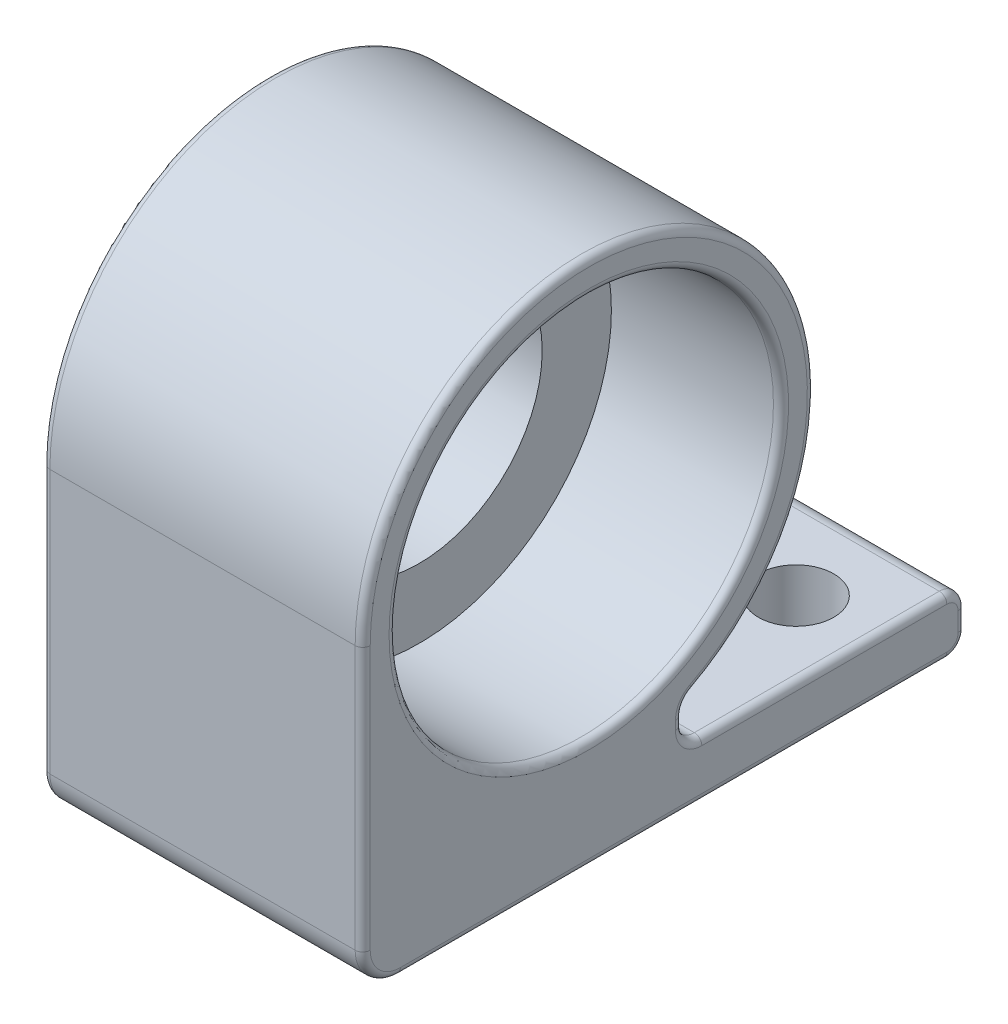
from build123d import *

# Parameters (mm, degrees)
EXTRUDE_1_DEPTH             = 8.5
SKETCH_2_R                  = 2
CUT_EXTRUDE_1_DEPTH         = 10
SKETCH_6_R                  = 5.1
CUT_EXTRUDE_3_DEPTH         = 4.5
HOLE_WIZARD_5_16_18_1_D     = 6.5278
HOLE_WIZARD_5_16_18_1_DEPTH = 3.2
HOLE_WIZARD_5_16_18_1_TIP   = 1.961148974
CUT_EXTRUDE_2_REACH         = 20.125
SKETCH_5_R                  = 1
FILLET_1_R                  = 0.2


with BuildPart() as part:
    # 草图1 → 凸台-拉伸1 (new body)
    with BuildSketch(Plane(origin=(0, 0, 0), x_dir=(0, 0, -1), z_dir=(1, 0, 0))):
        with BuildLine():
            Line((0, -8), (9.5, -8))
            ThreePointArc((9.5, -8), (9.853553391, -7.853553391), (10, -7.5))
            Line((10, -7.5), (10, -7))
            ThreePointArc((10, -7), (9.853553391, -6.646446609), (9.5, -6.5))
            Line((9.5, -6.5), (3, -6.5))
            ThreePointArc((3, -6.5), (2.646446609, -6.353553391), (2.5, -6))
            Line((2.5, -6), (2.5, -5.766281297))
            ThreePointArc((2.5, -5.766281297), (2.572574793, -5.506844037), (2.769230769, -5.322721198))
            ThreePointArc((2.769230769, -5.322721198), (3.11324713, 5.129102486), (-6, 0))
            Line((-6, 0), (-6, -7))
            ThreePointArc((-6, -7), (-5.707106781, -7.707106781), (-5, -8))
            Line((-5, -8), (0, -8))
        make_face()
    extrude(amount=EXTRUDE_1_DEPTH)

    # 草图2 → 切除-拉伸1 (cut)
    with BuildSketch(Plane.ZY):
        Circle(SKETCH_2_R)
    extrude(amount=-CUT_EXTRUDE_1_DEPTH, mode=Mode.SUBTRACT)

    # 草图6 → 切除-拉伸3 (cut)
    with BuildSketch(Plane(origin=(8.5, 0, 0), x_dir=(0, 0, -1), z_dir=(1, 0, 0))):
        Circle(SKETCH_6_R)
    extrude(amount=-CUT_EXTRUDE_3_DEPTH, mode=Mode.SUBTRACT)

    # 5/16-18 螺纹孔1
    with Locations(Plane(origin=(4, 0, 0), x_dir=(0, 0, -1), z_dir=(1, 0, 0))):
        with Locations((0, 0)):
            Hole(HOLE_WIZARD_5_16_18_1_D / 2, depth=HOLE_WIZARD_5_16_18_1_DEPTH)
            with Locations((0, 0, -(HOLE_WIZARD_5_16_18_1_DEPTH + HOLE_WIZARD_5_16_18_1_TIP / 2))):  # 118° drill point
                Cone(0, HOLE_WIZARD_5_16_18_1_D / 2, HOLE_WIZARD_5_16_18_1_TIP, mode=Mode.SUBTRACT)

    # 草图5 → 切除-拉伸2 (cut, up to next)
    with BuildSketch(Plane(origin=(0, -6.5, 0), x_dir=(1, 0, 0), z_dir=(0, 1, 0)), mode=Mode.PRIVATE) as cut_extrude_2_sk1:
        with Locations(Location((2, 7.5, 0), (0, 0, 270))):
            Circle(SKETCH_5_R)
    cut_extrude_2_tool1 = extrude(cut_extrude_2_sk1.sketch, amount=-CUT_EXTRUDE_2_REACH, mode=Mode.PRIVATE) & part.part
    # 草图5 → 切除-拉伸2 (cut, up to next)
    with BuildSketch(Plane(origin=(0, -6.5, 0), x_dir=(1, 0, 0), z_dir=(0, 1, 0)), mode=Mode.PRIVATE) as cut_extrude_2_sk2:
        with Locations(Location((6.5, 7.5, 0), (0, 0, 270))):
            Circle(SKETCH_5_R)
    cut_extrude_2_tool2 = extrude(cut_extrude_2_sk2.sketch, amount=-CUT_EXTRUDE_2_REACH, mode=Mode.PRIVATE) & part.part
    add(cut_extrude_2_tool1.solids().sort_by_distance((2, -6.5, -7.5))[0], mode=Mode.SUBTRACT)
    add(cut_extrude_2_tool2.solids().sort_by_distance((6.5, -6.5, -7.5))[0], mode=Mode.SUBTRACT)

    # 圆角1
    # the kernel refuses this fillet: 0.2 mm, written as the material it takes off along each edge
    with BuildSketch(Plane(origin=(8.5, -7, -9.5), x_dir=(0, 0, -1), z_dir=(0, -1, 0))) as fillet_1_piece_1:
        with BuildLine():
            CenterArc((0.5 - FILLET_1_R, -FILLET_1_R), FILLET_1_R, 0, 90)
            Line((0.5, -FILLET_1_R), (0.5 + FILLET_1_R * 0.02, -FILLET_1_R))
            Line((0.5 + FILLET_1_R * 0.02, -FILLET_1_R), (0.5 + FILLET_1_R * 0.02, FILLET_1_R * 0.02))
            Line((0.5 + FILLET_1_R * 0.02, FILLET_1_R * 0.02), (0.5 - FILLET_1_R, FILLET_1_R * 0.02))
            Line((0.5 - FILLET_1_R, FILLET_1_R * 0.02), (0.5 - FILLET_1_R, 0))
        make_face()
    revolve(axis=Axis((8.5, -7, -9.5), (1, 0, 0)), revolution_arc=90, mode=Mode.SUBTRACT)
    with BuildSketch(Plane(origin=(0, -8, 5), x_dir=(0, 1, 0), z_dir=(0, 0, -1)), Plane(origin=(8.5, -8, -9.5), x_dir=(0, 1, 0), z_dir=(0, 0, 1))) as fillet_1_piece_2:
        with BuildLine():
            CenterArc((FILLET_1_R, FILLET_1_R), FILLET_1_R, 180, 90)
            Line((0, FILLET_1_R), (-FILLET_1_R * 0.02, FILLET_1_R))
            Line((-FILLET_1_R * 0.02, FILLET_1_R), (-FILLET_1_R * 0.02, -FILLET_1_R * 0.02))
            Line((-FILLET_1_R * 0.02, -FILLET_1_R * 0.02), (FILLET_1_R, -FILLET_1_R * 0.02))
            Line((FILLET_1_R, -FILLET_1_R * 0.02), (FILLET_1_R, 0))
        make_face()
    extrude(amount=14.5, mode=Mode.SUBTRACT)
    with BuildSketch(Plane(origin=(0, -7, 5), x_dir=(0, 0, 1), z_dir=(0, 1, 0))) as fillet_1_piece_3:
        with BuildLine():
            CenterArc((1 - FILLET_1_R, FILLET_1_R), FILLET_1_R, 270, 90)
            Line((1 - FILLET_1_R, 0), (1 - FILLET_1_R, -FILLET_1_R * 0.02))
            Line((1 - FILLET_1_R, -FILLET_1_R * 0.02), (1 + FILLET_1_R * 0.02, -FILLET_1_R * 0.02))
            Line((1 + FILLET_1_R * 0.02, -FILLET_1_R * 0.02), (1 + FILLET_1_R * 0.02, FILLET_1_R))
            Line((1 + FILLET_1_R * 0.02, FILLET_1_R), (1, FILLET_1_R))
        make_face()
    revolve(axis=Axis((0, -7, 5), (1, 0, 0)), revolution_arc=90, mode=Mode.SUBTRACT)
    with BuildSketch(Plane(origin=(0, 0, 6), x_dir=(1, 0, 0), z_dir=(0, -1, 0))) as fillet_1_piece_4:
        with BuildLine():
            CenterArc((FILLET_1_R, -FILLET_1_R), FILLET_1_R, 90, 90)
            Line((0, -FILLET_1_R), (-FILLET_1_R * 0.02, -FILLET_1_R))
            Line((-FILLET_1_R * 0.02, -FILLET_1_R), (-FILLET_1_R * 0.02, FILLET_1_R * 0.02))
            Line((-FILLET_1_R * 0.02, FILLET_1_R * 0.02), (FILLET_1_R, FILLET_1_R * 0.02))
            Line((FILLET_1_R, FILLET_1_R * 0.02), (FILLET_1_R, 0))
        make_face()
    extrude(amount=7, mode=Mode.SUBTRACT)
    with BuildSketch(Plane(origin=(0, 0, 0), x_dir=(0, -0.8871201995900613, -0.46153846153846145), z_dir=(0, -0.46153846153846145, 0.8871201995900613))) as fillet_1_piece_5:
        with BuildLine():
            CenterArc((6 - FILLET_1_R, FILLET_1_R), FILLET_1_R, 270, 90)
            Line((6 - FILLET_1_R, 0), (6 - FILLET_1_R, -FILLET_1_R * 0.02))
            Line((6 - FILLET_1_R, -FILLET_1_R * 0.02), (6 + FILLET_1_R * 0.02, -FILLET_1_R * 0.02))
            Line((6 + FILLET_1_R * 0.02, -FILLET_1_R * 0.02), (6 + FILLET_1_R * 0.02, FILLET_1_R))
            Line((6 + FILLET_1_R * 0.02, FILLET_1_R), (6, FILLET_1_R))
        make_face()
    revolve(axis=Axis((0, 0, 0), (1, 0, 0)), revolution_arc=242.51357375, mode=Mode.SUBTRACT)
    with BuildSketch(Plane(origin=(0, -5.766281297, -3), x_dir=(0, 0, 1), z_dir=(0, -1, 0))) as fillet_1_piece_6:
        with BuildLine():
            CenterArc((0.5 + FILLET_1_R, -FILLET_1_R), FILLET_1_R, 90, 90)
            Line((0.5, -FILLET_1_R), (0.5 - FILLET_1_R * 0.02, -FILLET_1_R))
            Line((0.5 - FILLET_1_R * 0.02, -FILLET_1_R), (0.5 - FILLET_1_R * 0.02, FILLET_1_R * 0.02))
            Line((0.5 - FILLET_1_R * 0.02, FILLET_1_R * 0.02), (0.5 + FILLET_1_R, FILLET_1_R * 0.02))
            Line((0.5 + FILLET_1_R, FILLET_1_R * 0.02), (0.5 + FILLET_1_R, 0))
        make_face()
    revolve(axis=Axis((0, -5.766281297, -3), (-1, 0, 0)), revolution_arc=62.51357375, mode=Mode.SUBTRACT)
    with BuildSketch(Plane(origin=(8.5, -6.5, -9.5), x_dir=(0, -1, 0), z_dir=(0, 0, 1))) as fillet_1_piece_7:
        with BuildLine():
            CenterArc((FILLET_1_R, -FILLET_1_R), FILLET_1_R, 90, 90)
            Line((0, -FILLET_1_R), (-FILLET_1_R * 0.02, -FILLET_1_R))
            Line((-FILLET_1_R * 0.02, -FILLET_1_R), (-FILLET_1_R * 0.02, FILLET_1_R * 0.02))
            Line((-FILLET_1_R * 0.02, FILLET_1_R * 0.02), (FILLET_1_R, FILLET_1_R * 0.02))
            Line((FILLET_1_R, FILLET_1_R * 0.02), (FILLET_1_R, 0))
        make_face()
    extrude(amount=6.5, mode=Mode.SUBTRACT)
    with BuildSketch(Plane(origin=(0, -6, -2.5), x_dir=(0, 0, 1), z_dir=(0, 1, 0))) as fillet_1_piece_8:
        with BuildLine():
            CenterArc((FILLET_1_R, FILLET_1_R), FILLET_1_R, 180, 90)
            Line((0, FILLET_1_R), (-FILLET_1_R * 0.02, FILLET_1_R))
            Line((-FILLET_1_R * 0.02, FILLET_1_R), (-FILLET_1_R * 0.02, -FILLET_1_R * 0.02))
            Line((-FILLET_1_R * 0.02, -FILLET_1_R * 0.02), (FILLET_1_R, -FILLET_1_R * 0.02))
            Line((FILLET_1_R, -FILLET_1_R * 0.02), (FILLET_1_R, 0))
        make_face()
    extrude(amount=0.233718703, mode=Mode.SUBTRACT)
    with BuildSketch(Plane(origin=(0, -6, -3), x_dir=(0, -1, 0), z_dir=(0, 0, -1))) as fillet_1_piece_9:
        with BuildLine():
            CenterArc((0.5 + FILLET_1_R, -FILLET_1_R), FILLET_1_R, 90, 90)
            Line((0.5, -FILLET_1_R), (0.5 - FILLET_1_R * 0.02, -FILLET_1_R))
            Line((0.5 - FILLET_1_R * 0.02, -FILLET_1_R), (0.5 - FILLET_1_R * 0.02, FILLET_1_R * 0.02))
            Line((0.5 - FILLET_1_R * 0.02, FILLET_1_R * 0.02), (0.5 + FILLET_1_R, FILLET_1_R * 0.02))
            Line((0.5 + FILLET_1_R, FILLET_1_R * 0.02), (0.5 + FILLET_1_R, 0))
        make_face()
    revolve(axis=Axis((0, -6, -3), (-1, 0, 0)), revolution_arc=90, mode=Mode.SUBTRACT)
    with BuildSketch(Plane(origin=(0, -6.5, -9.5), x_dir=(0, -1, 0), z_dir=(0, 0, 1))) as fillet_1_piece_10:
        with BuildLine():
            CenterArc((FILLET_1_R, FILLET_1_R), FILLET_1_R, 180, 90)
            Line((0, FILLET_1_R), (-FILLET_1_R * 0.02, FILLET_1_R))
            Line((-FILLET_1_R * 0.02, FILLET_1_R), (-FILLET_1_R * 0.02, -FILLET_1_R * 0.02))
            Line((-FILLET_1_R * 0.02, -FILLET_1_R * 0.02), (FILLET_1_R, -FILLET_1_R * 0.02))
            Line((FILLET_1_R, -FILLET_1_R * 0.02), (FILLET_1_R, 0))
        make_face()
    extrude(amount=6.5, mode=Mode.SUBTRACT)
    with BuildSketch(Plane(origin=(0, -7, -9.5), x_dir=(0, 0, -1), z_dir=(0, -1, 0))) as fillet_1_piece_11:
        with BuildLine():
            CenterArc((0.5 - FILLET_1_R, FILLET_1_R), FILLET_1_R, 270, 90)
            Line((0.5, FILLET_1_R), (0.5 + FILLET_1_R * 0.02, FILLET_1_R))
            Line((0.5 + FILLET_1_R * 0.02, FILLET_1_R), (0.5 + FILLET_1_R * 0.02, -FILLET_1_R * 0.02))
            Line((0.5 + FILLET_1_R * 0.02, -FILLET_1_R * 0.02), (0.5 - FILLET_1_R, -FILLET_1_R * 0.02))
            Line((0.5 - FILLET_1_R, -FILLET_1_R * 0.02), (0.5 - FILLET_1_R, 0))
        make_face()
    revolve(axis=Axis((0, -7, -9.5), (1, 0, 0)), revolution_arc=90, mode=Mode.SUBTRACT)
    with BuildSketch(Plane(origin=(0, -7.5, -10), x_dir=(0, 0, 1), z_dir=(0, 1, 0))) as fillet_1_piece_12:
        with BuildLine():
            CenterArc((FILLET_1_R, FILLET_1_R), FILLET_1_R, 180, 90)
            Line((0, FILLET_1_R), (-FILLET_1_R * 0.02, FILLET_1_R))
            Line((-FILLET_1_R * 0.02, FILLET_1_R), (-FILLET_1_R * 0.02, -FILLET_1_R * 0.02))
            Line((-FILLET_1_R * 0.02, -FILLET_1_R * 0.02), (FILLET_1_R, -FILLET_1_R * 0.02))
            Line((FILLET_1_R, -FILLET_1_R * 0.02), (FILLET_1_R, 0))
        make_face()
    extrude(amount=0.5, mode=Mode.SUBTRACT)
    with BuildSketch(Plane(origin=(0, -7.5, -9.5), x_dir=(0, -1, 0), z_dir=(0, 0, 1))) as fillet_1_piece_13:
        with BuildLine():
            CenterArc((0.5 - FILLET_1_R, FILLET_1_R), FILLET_1_R, 270, 90)
            Line((0.5, FILLET_1_R), (0.5 + FILLET_1_R * 0.02, FILLET_1_R))
            Line((0.5 + FILLET_1_R * 0.02, FILLET_1_R), (0.5 + FILLET_1_R * 0.02, -FILLET_1_R * 0.02))
            Line((0.5 + FILLET_1_R * 0.02, -FILLET_1_R * 0.02), (0.5 - FILLET_1_R, -FILLET_1_R * 0.02))
            Line((0.5 - FILLET_1_R, -FILLET_1_R * 0.02), (0.5 - FILLET_1_R, 0))
        make_face()
    revolve(axis=Axis((0, -7.5, -9.5), (1, 0, 0)), revolution_arc=90, mode=Mode.SUBTRACT)
    with BuildSketch(Plane(origin=(8.5, -6, -3), x_dir=(0, -1, 0), z_dir=(0, 0, -1))) as fillet_1_piece_14:
        with BuildLine():
            CenterArc((0.5 + FILLET_1_R, FILLET_1_R), FILLET_1_R, 180, 90)
            Line((0.5, FILLET_1_R), (0.5 - FILLET_1_R * 0.02, FILLET_1_R))
            Line((0.5 - FILLET_1_R * 0.02, FILLET_1_R), (0.5 - FILLET_1_R * 0.02, -FILLET_1_R * 0.02))
            Line((0.5 - FILLET_1_R * 0.02, -FILLET_1_R * 0.02), (0.5 + FILLET_1_R, -FILLET_1_R * 0.02))
            Line((0.5 + FILLET_1_R, -FILLET_1_R * 0.02), (0.5 + FILLET_1_R, 0))
        make_face()
    revolve(axis=Axis((8.5, -6, -3), (-1, 0, 0)), revolution_arc=90, mode=Mode.SUBTRACT)
    with BuildSketch(Plane(origin=(8.5, -6, -2.5), x_dir=(0, 0, 1), z_dir=(0, 1, 0))) as fillet_1_piece_15:
        with BuildLine():
            CenterArc((FILLET_1_R, -FILLET_1_R), FILLET_1_R, 90, 90)
            Line((0, -FILLET_1_R), (-FILLET_1_R * 0.02, -FILLET_1_R))
            Line((-FILLET_1_R * 0.02, -FILLET_1_R), (-FILLET_1_R * 0.02, FILLET_1_R * 0.02))
            Line((-FILLET_1_R * 0.02, FILLET_1_R * 0.02), (FILLET_1_R, FILLET_1_R * 0.02))
            Line((FILLET_1_R, FILLET_1_R * 0.02), (FILLET_1_R, 0))
        make_face()
    extrude(amount=0.233718703, mode=Mode.SUBTRACT)
    with BuildSketch(Plane(origin=(8.5, -5.766281297, -3), x_dir=(0, 0, 1), z_dir=(0, -1, 0))) as fillet_1_piece_16:
        with BuildLine():
            CenterArc((0.5 + FILLET_1_R, FILLET_1_R), FILLET_1_R, 180, 90)
            Line((0.5, FILLET_1_R), (0.5 - FILLET_1_R * 0.02, FILLET_1_R))
            Line((0.5 - FILLET_1_R * 0.02, FILLET_1_R), (0.5 - FILLET_1_R * 0.02, -FILLET_1_R * 0.02))
            Line((0.5 - FILLET_1_R * 0.02, -FILLET_1_R * 0.02), (0.5 + FILLET_1_R, -FILLET_1_R * 0.02))
            Line((0.5 + FILLET_1_R, -FILLET_1_R * 0.02), (0.5 + FILLET_1_R, 0))
        make_face()
    revolve(axis=Axis((8.5, -5.766281297, -3), (-1, 0, 0)), revolution_arc=62.51357375, mode=Mode.SUBTRACT)
    with BuildSketch(Plane(origin=(8.5, 0, 0), x_dir=(0, -0.8871201995900613, -0.46153846153846145), z_dir=(0, -0.46153846153846145, 0.8871201995900613))) as fillet_1_piece_17:
        with BuildLine():
            CenterArc((6 - FILLET_1_R, -FILLET_1_R), FILLET_1_R, 0, 90)
            Line((6 - FILLET_1_R, 0), (6 - FILLET_1_R, FILLET_1_R * 0.02))
            Line((6 - FILLET_1_R, FILLET_1_R * 0.02), (6 + FILLET_1_R * 0.02, FILLET_1_R * 0.02))
            Line((6 + FILLET_1_R * 0.02, FILLET_1_R * 0.02), (6 + FILLET_1_R * 0.02, -FILLET_1_R))
            Line((6 + FILLET_1_R * 0.02, -FILLET_1_R), (6, -FILLET_1_R))
        make_face()
    revolve(axis=Axis((8.5, 0, 0), (1, 0, 0)), revolution_arc=242.51357375, mode=Mode.SUBTRACT)
    with BuildSketch(Plane(origin=(8.5, 0, 6), x_dir=(-1, 0, 0), z_dir=(0, -1, 0))) as fillet_1_piece_18:
        with BuildLine():
            CenterArc((FILLET_1_R, FILLET_1_R), FILLET_1_R, 180, 90)
            Line((0, FILLET_1_R), (-FILLET_1_R * 0.02, FILLET_1_R))
            Line((-FILLET_1_R * 0.02, FILLET_1_R), (-FILLET_1_R * 0.02, -FILLET_1_R * 0.02))
            Line((-FILLET_1_R * 0.02, -FILLET_1_R * 0.02), (FILLET_1_R, -FILLET_1_R * 0.02))
            Line((FILLET_1_R, -FILLET_1_R * 0.02), (FILLET_1_R, 0))
        make_face()
    extrude(amount=7, mode=Mode.SUBTRACT)
    with BuildSketch(Plane(origin=(8.5, -7, 5), x_dir=(0, 0, 1), z_dir=(0, 1, 0))) as fillet_1_piece_19:
        with BuildLine():
            CenterArc((1 - FILLET_1_R, -FILLET_1_R), FILLET_1_R, 0, 90)
            Line((1 - FILLET_1_R, 0), (1 - FILLET_1_R, FILLET_1_R * 0.02))
            Line((1 - FILLET_1_R, FILLET_1_R * 0.02), (1 + FILLET_1_R * 0.02, FILLET_1_R * 0.02))
            Line((1 + FILLET_1_R * 0.02, FILLET_1_R * 0.02), (1 + FILLET_1_R * 0.02, -FILLET_1_R))
            Line((1 + FILLET_1_R * 0.02, -FILLET_1_R), (1, -FILLET_1_R))
        make_face()
    revolve(axis=Axis((8.5, -7, 5), (1, 0, 0)), revolution_arc=90, mode=Mode.SUBTRACT)
    with BuildSketch(Plane(origin=(0, 0, 0), x_dir=(0, 0, 1), z_dir=(0, -1, 0))) as fillet_1_piece_20:
        with BuildLine():
            CenterArc((2.120759252, -0.2), FILLET_1_R, 90, 37.142271212)
            Line((2, -0.040572264), (1.997584815, -0.037383709))
            ThreePointArc((1.997584815, -0.037383709), (1.996, -0.020286132), (1.996, 0))
            Line((1.996, 0), (2, 0.004))
            Line((2, 0.004), (2.120759252, 0.004))
            Line((2.120759252, 0.004), (2.120759252, 0))
        make_face()
    revolve(axis=Axis((0, 0, 0), (-1, 0, 0)), mode=Mode.SUBTRACT)
    with BuildSketch(Plane(origin=(8.5, -7.5, -9.5), x_dir=(0, -1, 0), z_dir=(0, 0, 1))) as fillet_1_piece_21:
        with BuildLine():
            CenterArc((0.5 - FILLET_1_R, -FILLET_1_R), FILLET_1_R, 0, 90)
            Line((0.5, -FILLET_1_R), (0.5 + FILLET_1_R * 0.02, -FILLET_1_R))
            Line((0.5 + FILLET_1_R * 0.02, -FILLET_1_R), (0.5 + FILLET_1_R * 0.02, FILLET_1_R * 0.02))
            Line((0.5 + FILLET_1_R * 0.02, FILLET_1_R * 0.02), (0.5 - FILLET_1_R, FILLET_1_R * 0.02))
            Line((0.5 - FILLET_1_R, FILLET_1_R * 0.02), (0.5 - FILLET_1_R, 0))
        make_face()
    revolve(axis=Axis((8.5, -7.5, -9.5), (1, 0, 0)), revolution_arc=90, mode=Mode.SUBTRACT)
    with BuildSketch(Plane(origin=(8.5, 0, 0), x_dir=(0, 0, -1), z_dir=(0, -1, 0))) as fillet_1_piece_22:
        with BuildLine():
            CenterArc((5.1 + FILLET_1_R, -FILLET_1_R), FILLET_1_R, 90, 90)
            Line((5.1, -FILLET_1_R), (5.1 - FILLET_1_R * 0.02, -FILLET_1_R))
            Line((5.1 - FILLET_1_R * 0.02, -FILLET_1_R), (5.1 - FILLET_1_R * 0.02, FILLET_1_R * 0.02))
            Line((5.1 - FILLET_1_R * 0.02, FILLET_1_R * 0.02), (5.1 + FILLET_1_R, FILLET_1_R * 0.02))
            Line((5.1 + FILLET_1_R, FILLET_1_R * 0.02), (5.1 + FILLET_1_R, 0))
        make_face()
    revolve(axis=Axis((8.5, 0, 0), (1, 0, 0)), mode=Mode.SUBTRACT)
    with BuildSketch(Plane(origin=(8.5, -7.5, -10), x_dir=(0, 0, 1), z_dir=(0, 1, 0))) as fillet_1_piece_23:
        with BuildLine():
            CenterArc((FILLET_1_R, -FILLET_1_R), FILLET_1_R, 90, 90)
            Line((0, -FILLET_1_R), (-FILLET_1_R * 0.02, -FILLET_1_R))
            Line((-FILLET_1_R * 0.02, -FILLET_1_R), (-FILLET_1_R * 0.02, FILLET_1_R * 0.02))
            Line((-FILLET_1_R * 0.02, FILLET_1_R * 0.02), (FILLET_1_R, FILLET_1_R * 0.02))
            Line((FILLET_1_R, FILLET_1_R * 0.02), (FILLET_1_R, 0))
        make_face()
    extrude(amount=0.5, mode=Mode.SUBTRACT)


solid = part.part
